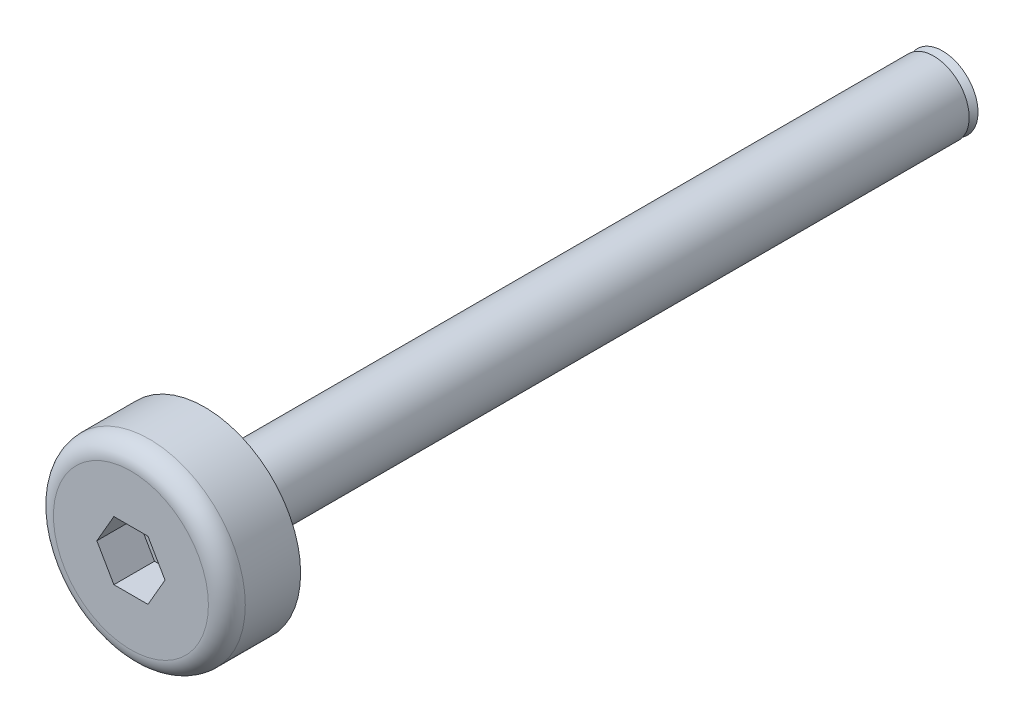
from build123d import *

# Parameters (mm, degrees)
F_0105_CYLINDER_SKETCH_R    = 3.25
F_0105_CYLINDER_DEPTH       = 2.5
F_0106_FILLET_R             = 0.625
F_0107_EXTRUDE_DEPTH        = 1.385
F_0107_EXTRUDE_ROTATE_ANGLE = 120
F_0110_CYLINDER_SKETCH_R    = 1.2
F_0110_CYLINDER_DEPTH       = 24.7
F_0111_CONE_ROTATE_ANGLE    = 90


with BuildPart() as part:
    # 0105_cylinder_Sketch → 0105_cylinder (new body)
    with BuildSketch(Plane.XY):
        Circle(F_0105_CYLINDER_SKETCH_R)
    extrude(amount=F_0105_CYLINDER_DEPTH)

    # 0106_fillet
    f_0106_fillet_edges = [part.edges().sort_by_distance(p)[0] for p in [
        (-3.25, 0, 2.5),
    ]]
    fillet(f_0106_fillet_edges, radius=F_0106_FILLET_R)


with BuildPart() as body_2:
    # 0107_extrude_Sketch → 0107_extrude (new body)
    with BuildSketch(Plane.XY):
        Polygon((0, 0), (1.154700538, 0), (1.732050808, 1), (1.154700538, 2), (0, 2), (-0.577350269, 1), align=None)
    extrude(amount=F_0107_EXTRUDE_DEPTH)


with BuildPart() as body_2_1:
    # 0107_extrude_Rotate: read off the stored shape, not the designer's step
    # 0107_extrude_Rotate: moved
    add(body_2.part.rotate(Axis((0, 0, 0), (0, 0, 1)), F_0107_EXTRUDE_ROTATE_ANGLE))


with BuildPart() as body_2_2:
    # 0107_extrude_Translate: moved
    add(body_2_1.part.moved(Location((1.154700538, 0, 1.125))))


with BuildPart() as part_1:
    add(part.part)

    # 0109_sub: cut body 2
    add(body_2_2.part, mode=Mode.SUBTRACT)


with BuildPart() as body_2_2_1:
    # 0110_cylinder_Sketch → 0110_cylinder (new body)
    with BuildSketch(Plane.XY):
        Circle(F_0110_CYLINDER_SKETCH_R)
    extrude(amount=F_0110_CYLINDER_DEPTH)


with BuildPart() as body_2_2_2:
    # 0110_cylinder_Translate: moved
    add(body_2_2_1.part.moved(Location((0, 0, -24.7))))


with BuildPart() as body_3:
    # 0111_cone_Sketch → 0111_cone (revolve)
    with BuildSketch(Plane.XY, mode=Mode.PRIVATE) as f_0111_cone_sk:
        Polygon((0, 0), (1.2, 0), (0.9, 0.3), (0, 0.3), align=None)
    revolve(f_0111_cone_sk.sketch.rotate(Axis((0, -100, 0), (0, 1, 0)), 90), axis=Axis((0, -100, 0), (0, 1, 0)))


with BuildPart() as body_3_1:
    # 0111_cone_Rotate: moved
    add(body_3.part.rotate(Axis((0, 0, 0), (1, 0, 0)), F_0111_CONE_ROTATE_ANGLE))


with BuildPart() as body_3_2:
    # 0111_cone_Translate: moved
    add(body_3_1.part.moved(Location((0, 0, -25))))


with BuildPart() as body_2_2_3:
    add(body_2_2_2.part)

    # 0113_add: union body 3
    add(body_3_2.part)


with BuildPart() as part_2:
    add(part_1.part)

    # 0114_add: union body 2 2
    add(body_2_2_3.part)


solid = part_2.part
